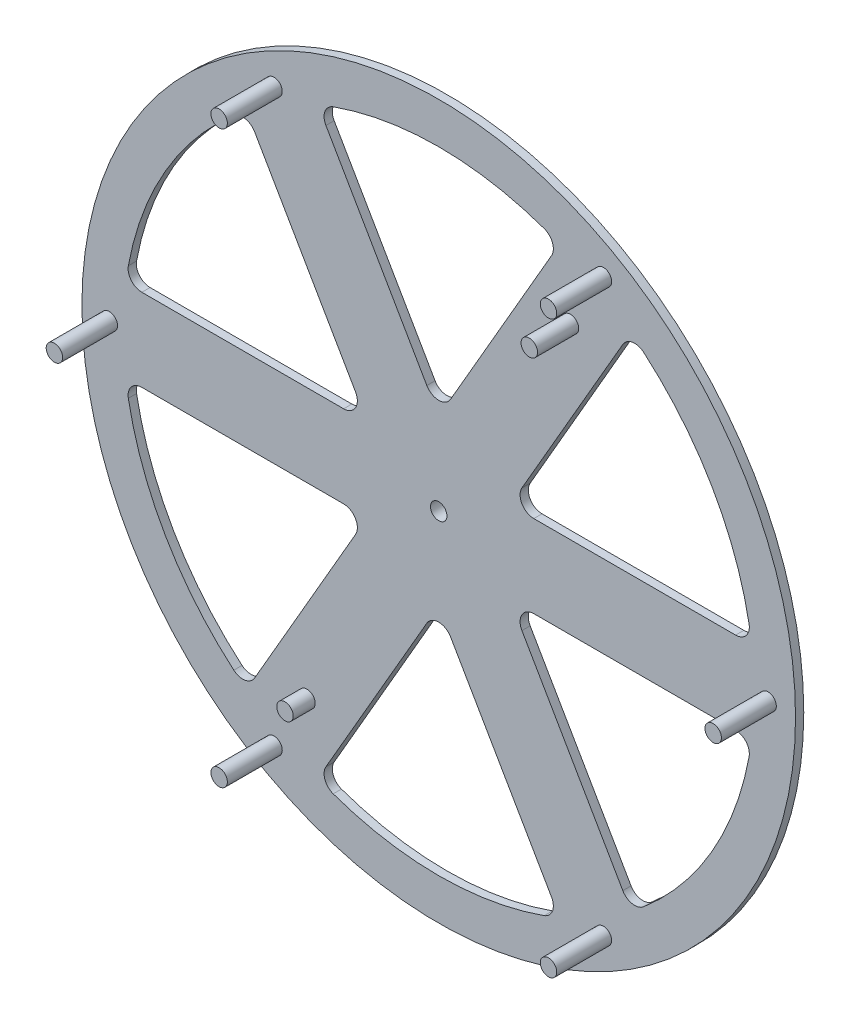
from build123d import *
from build123d.topology import SkipClean

# Parameters (mm, degrees)
SKETCH_1_R          = 130
EXTRUDE_1_DEPTH     = 3
SKETCH_2_R          = 3
EXTRUDE_2_DEPTH     = 20
EXTRUDE_2_2_DEPTH   = 20
EXTRUDE_2_3_DEPTH   = 20
EXTRUDE_2_4_DEPTH   = 20
EXTRUDE_2_5_DEPTH   = 20
EXTRUDE_2_6_DEPTH   = 20
CUT_EXTRUDE_1_DEPTH = 3
SKETCH_5_R          = 3
EXTRUDE_4_DEPTH     = 8
SKETCH_6_R          = 3
EXTRUDE_5_DEPTH     = 15
SKETCH_3_R          = 3
CUT_EXTRUDE_2_DEPTH = 3
SKETCH_7_R          = 6
SKETCH_7_R_2        = 3
EXTRUDE_1_2_DEPTH   = 2


with BuildPart() as part:
    # 草图1 → Extrude 1 (new body)
    with BuildSketch(Plane.XY):
        Circle(SKETCH_1_R)
    extrude(amount=-EXTRUDE_1_DEPTH)

    # 草图4 → 切除-拉伸1 (cut)
    with BuildSketch(Plane.XY):
        with BuildLine():
            Line((-30.310889132, -22.5), (-67.073650189, -86.174969976))
            ThreePointArc((-67.073650189, -86.174969976), (-70.555983948, -88.602570466), (-74.649403444, -87.478377702))
            ThreePointArc((-74.649403444, -87.478377702), (-99.592921435, -57.5), (-113.083199094, -20.909090909))
            ThreePointArc((-113.083199094, -20.909090909), (-112.010068838, -16.801989255), (-108.166538264, -15))
            Line((-108.166538264, -15), (-34.641016151, -15))
            ThreePointArc((-34.641016151, -15), (-30.310889132, -17.5), (-30.310889132, -22.5))
        make_face()
        with BuildLine():
            Line((-34.641016151, 15), (-108.166538264, 15))
            ThreePointArc((-108.166538264, 15), (-112.010068838, 16.801989255), (-113.083199094, 20.909090909))
            ThreePointArc((-113.083199094, 20.909090909), (-99.592921435, 57.5), (-74.649403444, 87.478377702))
            ThreePointArc((-74.649403444, 87.478377702), (-70.555983948, 88.602570466), (-67.073650189, 86.174969976))
            Line((-67.073650189, 86.174969976), (-30.310889132, 22.5))
            ThreePointArc((-30.310889132, 22.5), (-30.310889132, 17.5), (-34.641016151, 15))
        make_face()
        with BuildLine():
            Line((-4.330127019, 37.5), (-41.092888075, 101.174969976))
            ThreePointArc((-41.092888075, 101.174969976), (-41.45408489, 105.404559721), (-38.43379565, 108.387468611))
            ThreePointArc((-38.43379565, 108.387468611), (0, 115), (38.43379565, 108.387468611))
            ThreePointArc((38.43379565, 108.387468611), (41.45408489, 105.404559721), (41.092888075, 101.174969976))
            Line((41.092888075, 101.174969976), (4.330127019, 37.5))
            ThreePointArc((4.330127019, 37.5), (0, 35), (-4.330127019, 37.5))
        make_face()
        with BuildLine():
            Line((30.310889132, 22.5), (67.073650189, 86.174969976))
            ThreePointArc((67.073650189, 86.174969976), (70.555983948, 88.602570466), (74.649403444, 87.478377702))
            ThreePointArc((74.649403444, 87.478377702), (99.592921435, 57.5), (113.083199094, 20.909090909))
            ThreePointArc((113.083199094, 20.909090909), (112.010068838, 16.801989255), (108.166538264, 15))
            Line((108.166538264, 15), (34.641016151, 15))
            ThreePointArc((34.641016151, 15), (30.310889132, 17.5), (30.310889132, 22.5))
        make_face()
        with BuildLine():
            Line((34.641016151, -15), (108.166538264, -15))
            ThreePointArc((108.166538264, -15), (112.010068838, -16.801989255), (113.083199094, -20.909090909))
            ThreePointArc((113.083199094, -20.909090909), (99.592921435, -57.5), (74.649403444, -87.478377702))
            ThreePointArc((74.649403444, -87.478377702), (70.555983948, -88.602570466), (67.073650189, -86.174969976))
            Line((67.073650189, -86.174969976), (30.310889132, -22.5))
            ThreePointArc((30.310889132, -22.5), (30.310889132, -17.5), (34.641016151, -15))
        make_face()
        with BuildLine():
            Line((4.330127019, -37.5), (41.092888075, -101.174969976))
            ThreePointArc((41.092888075, -101.174969976), (41.45408489, -105.404559721), (38.43379565, -108.387468611))
            ThreePointArc((38.43379565, -108.387468611), (0, -115), (-38.43379565, -108.387468611))
            ThreePointArc((-38.43379565, -108.387468611), (-41.45408489, -105.404559721), (-41.092888075, -101.174969976))
            Line((-41.092888075, -101.174969976), (-4.330127019, -37.5))
            ThreePointArc((-4.330127019, -37.5), (0, -35), (4.330127019, -37.5))
        make_face()
    extrude(amount=-CUT_EXTRUDE_1_DEPTH, mode=Mode.SUBTRACT)

    # 草图5 → 凸台-拉伸4 (add)
    with BuildSketch(Plane.XY):
        with Locations((-48, -83.138438763)):
            Circle(SKETCH_5_R)
    extrude(amount=EXTRUDE_4_DEPTH)

    # 草图6 → 凸台-拉伸5 (add)
    with BuildSketch(Plane.XY):
        with Locations((48, 83.138438763)):
            Circle(SKETCH_6_R)
    extrude(amount=EXTRUDE_5_DEPTH)

    # 草图3 → 切除-拉伸2 (cut)
    with BuildSketch(Plane.XY):
        Circle(SKETCH_3_R)
    extrude(amount=-CUT_EXTRUDE_2_DEPTH, mode=Mode.SUBTRACT)

    # 草图7 → Extrude 1 2 (add)
    with SkipClean():  # the faces are left unmerged after this step: merging them gives an invalid solid
        with BuildSketch(Plane(origin=(0, 0, -3), x_dir=(-1, 0, 0), z_dir=(0, 0, -1))):
            Circle(SKETCH_7_R)
            Circle(SKETCH_7_R_2, mode=Mode.SUBTRACT)
        extrude(amount=EXTRUDE_1_2_DEPTH)
    add(part.part.scale(1), mode=Mode.REPLACE)  # the faces are merged on a copy


with BuildPart() as body_2:
    # 草图2 → 凸台-拉伸2 (new body)
    with BuildSketch(Plane.XY):
        with Locations((-120, 0)):
            Circle(SKETCH_2_R)
    extrude(amount=EXTRUDE_2_DEPTH)


with BuildPart() as body_3:
    # 草图2 → Extrude 2 2 (new body)
    with BuildSketch(Plane.XY):
        with Locations((-60, 103.923048454)):
            Circle(SKETCH_2_R)
    extrude(amount=EXTRUDE_2_2_DEPTH)


with BuildPart() as body_4:
    # 草图2 → Extrude 2 3 (new body)
    with BuildSketch(Plane.XY):
        with Locations((60, 103.923048454)):
            Circle(SKETCH_2_R)
    extrude(amount=EXTRUDE_2_3_DEPTH)


with BuildPart() as body_5:
    # 草图2 → Extrude 2 4 (new body)
    with BuildSketch(Plane.XY):
        with Locations((120, 0)):
            Circle(SKETCH_2_R)
    extrude(amount=EXTRUDE_2_4_DEPTH)


with BuildPart() as body_6:
    # 草图2 → Extrude 2 5 (new body)
    with BuildSketch(Plane.XY):
        with Locations((60, -103.923048454)):
            Circle(SKETCH_2_R)
    extrude(amount=EXTRUDE_2_5_DEPTH)


with BuildPart() as body_7:
    # 草图2 → Extrude 2 6 (new body)
    with BuildSketch(Plane.XY):
        with Locations((-60, -103.923048454)):
            Circle(SKETCH_2_R)
    extrude(amount=EXTRUDE_2_6_DEPTH)


solid = Compound([part.part, body_2.part, body_3.part, body_4.part, body_5.part, body_6.part, body_7.part])
